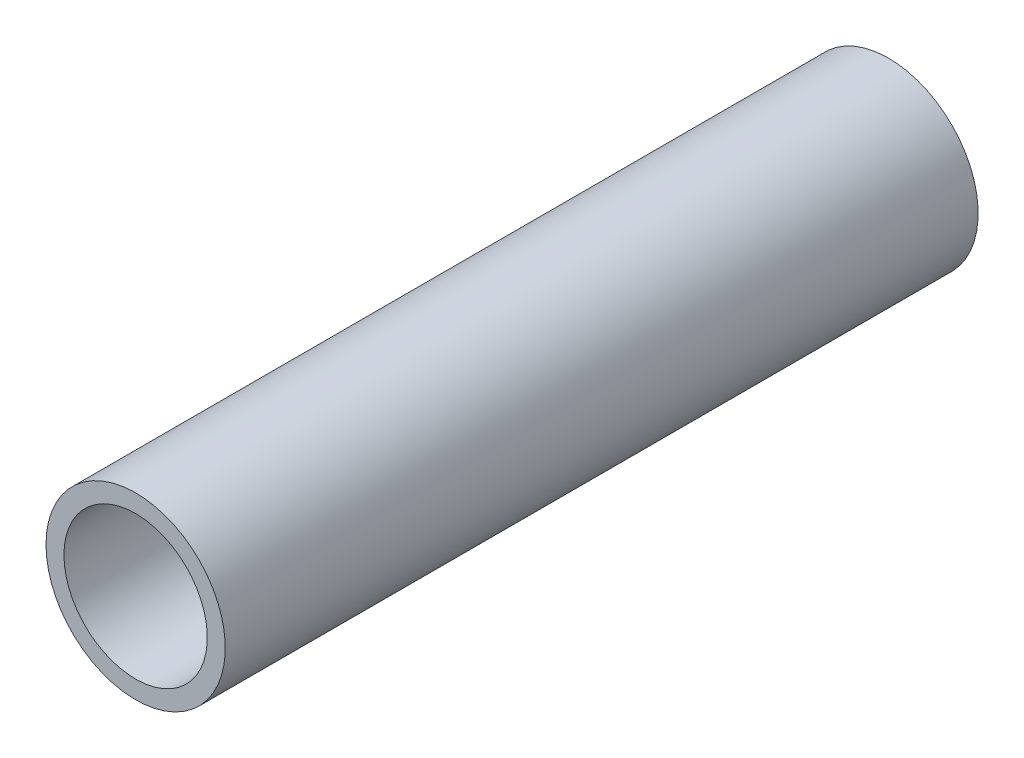
from build123d import *

# Parameters (mm, degrees)
SKETCH1_R           = 1.25
SKETCH1_R_2         = 1
TUBE_MCP_BODY_DEPTH = 10.5


with BuildPart() as part:
    # Sketch1 → Tube MCP Body (new body)
    with BuildSketch(Plane.XY):
        Circle(SKETCH1_R)
        Circle(SKETCH1_R_2, mode=Mode.SUBTRACT)
    extrude(amount=TUBE_MCP_BODY_DEPTH)


solid = part.part
